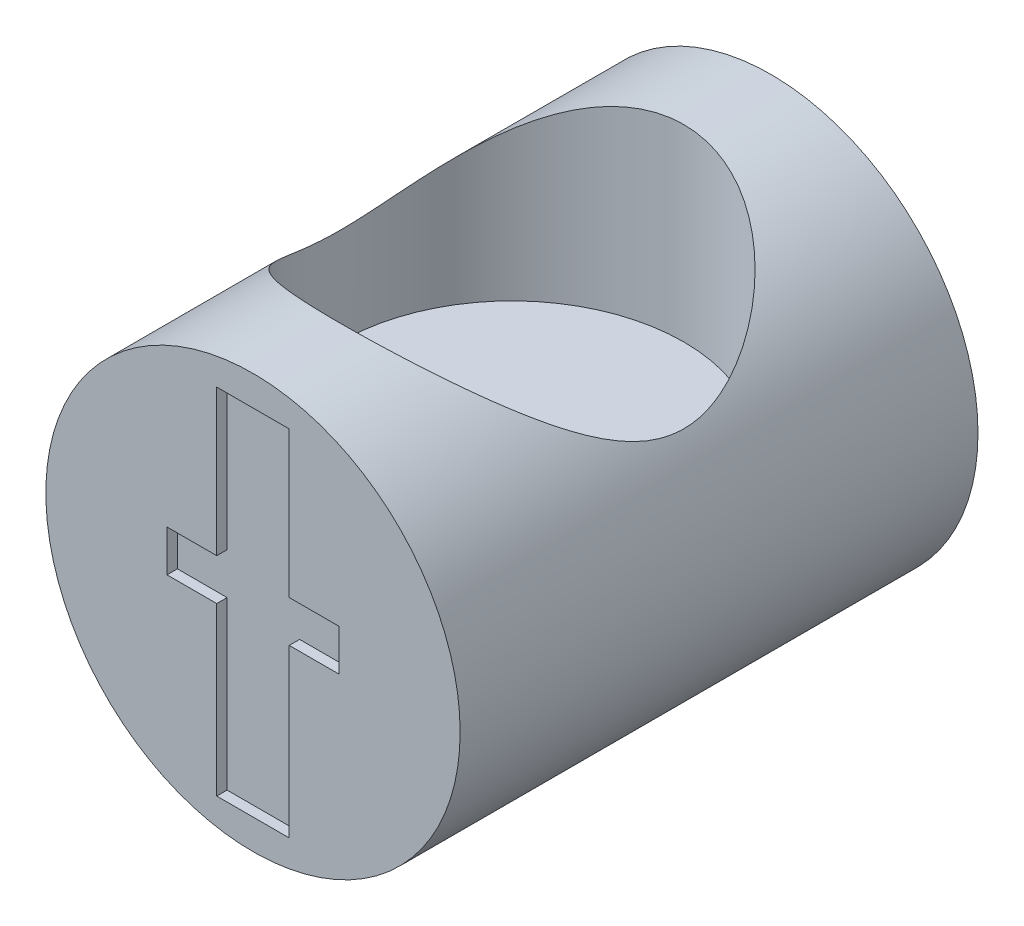
from build123d import *

# Parameters (mm, degrees)
CROQUIS1_R              = 20
SALIENTE_EXTRUIR1_DEPTH = 50
CROQUIS3D1_R            = 16.6
CORTAR_EXTRUIR2_DEPTH   = 12.2
CORTAR_EXTRUIR4_DEPTH   = 1
CROQUIS10_R             = 16.6
CORTAR_EXTRUIR5_DEPTH   = 6


with BuildPart() as part:
    # Croquis1 → Saliente-Extruir1 (new body)
    with BuildSketch(Plane.XY):
        Circle(CROQUIS1_R)
    extrude(amount=SALIENTE_EXTRUIR1_DEPTH)

    # Croquis3D1 → Cortar-Extruir2 (cut)
    with BuildSketch(Plane(origin=(0, 20.020318539, 25), x_dir=(1, 0, 0), z_dir=(0, -1, 0))):
        Circle(CROQUIS3D1_R)
    extrude(amount=CORTAR_EXTRUIR2_DEPTH, mode=Mode.SUBTRACT)

    # Croquis4 → Cortar-Extruir4 (cut)
    with BuildSketch(Plane.XY.offset(50)):
        Polygon((8.3, 3), (3.5, 3), (3.5, 17.1), (-3.5, 17.1), (-3.5, 3), (-8.3, 3), (-8.3, 1), (-8.3, -1), (-3.5, -1), (-3.5, -2), (-3.5, -17.1), (3.5, -17.1), (3.5, -2), (3.5, -1), (8.3, -1), (8.3, 1), align=None)
    extrude(amount=-CORTAR_EXTRUIR4_DEPTH, mode=Mode.SUBTRACT)

    # Croquis10 → Cortar-Extruir5 (cut)
    with BuildSketch(Plane(origin=(0, 7.820318539, 0), x_dir=(1, 0, 0), z_dir=(0, 1, 0))):
        with Locations((0, -25)):
            Circle(CROQUIS10_R)
    extrude(amount=-CORTAR_EXTRUIR5_DEPTH, mode=Mode.SUBTRACT)


solid = part.part
